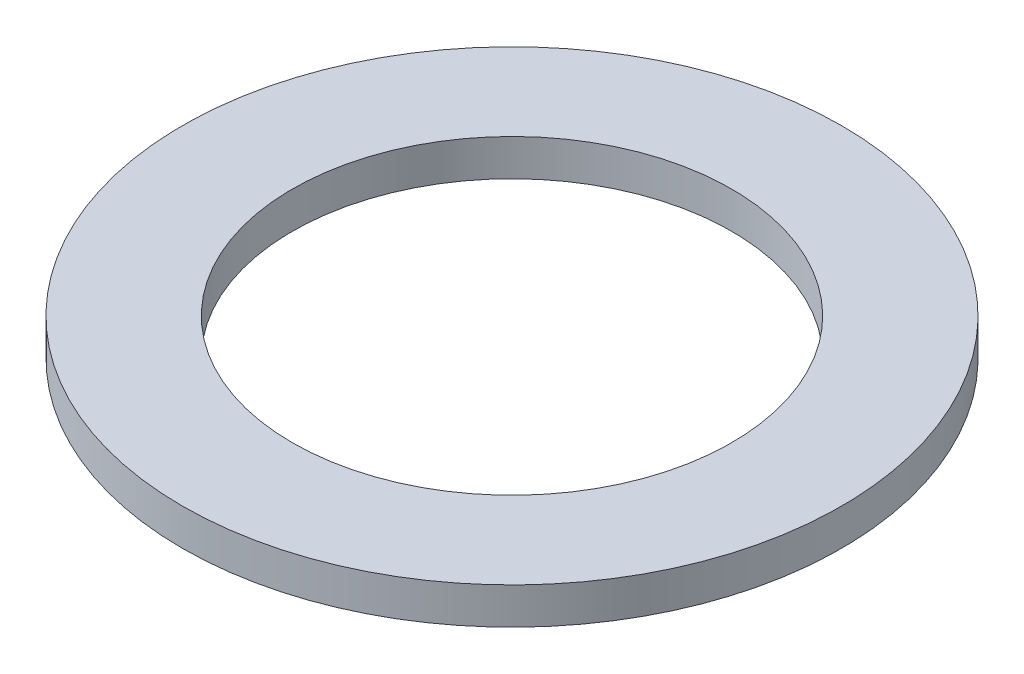
from build123d import *

# Parameters (mm, degrees)
SKETCH1_R           = 45
BOSS_EXTRUDE1_DEPTH = 5
SKETCH2_R           = 30
CUT_EXTRUDE1_DEPTH  = 64.835726674


with BuildPart() as part:
    # Sketch1 → Boss-Extrude1 (new body)
    with BuildSketch(Plane(origin=(0, 0, 0), x_dir=(1, 0, 0), z_dir=(0, 1, 0))):
        Circle(SKETCH1_R)
    extrude(amount=BOSS_EXTRUDE1_DEPTH)

    # Sketch2 → Cut-Extrude1 (cut, through all)
    with BuildSketch(Plane(origin=(0, 0, 0), x_dir=(1, 0, 0), z_dir=(0, 1, 0))):
        Circle(SKETCH2_R)
    extrude(amount=CUT_EXTRUDE1_DEPTH, mode=Mode.SUBTRACT)


solid = part.part
